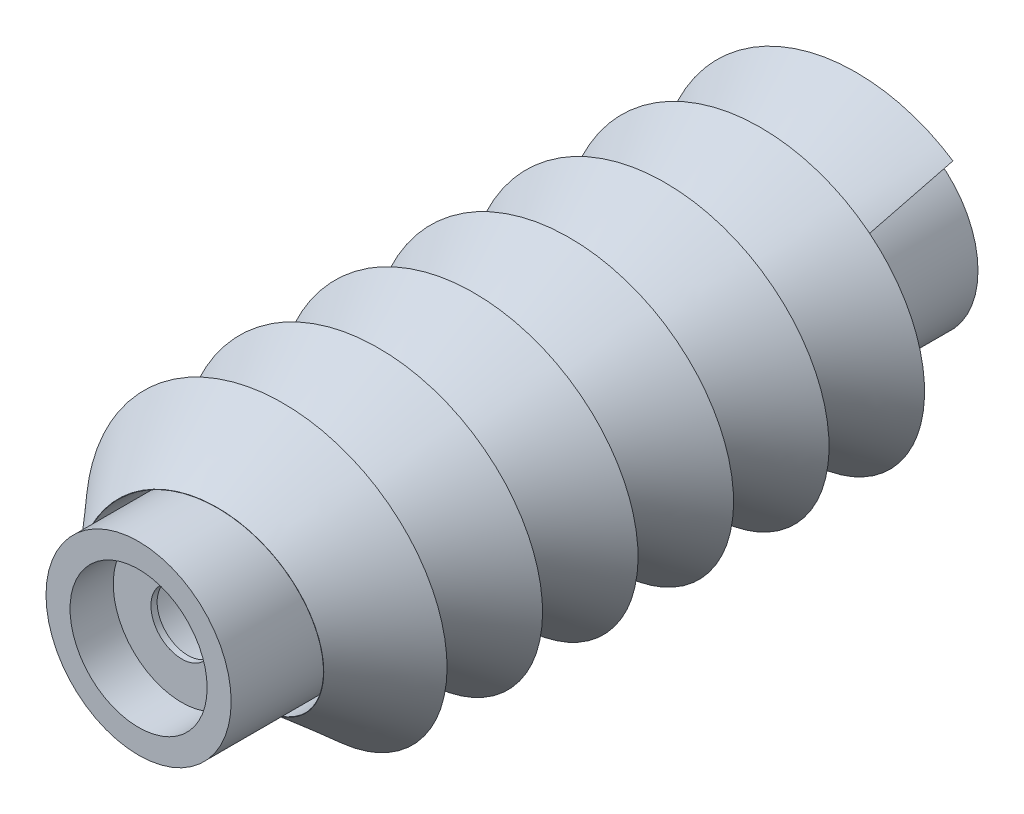
from build123d import *

# Parameters (mm, degrees)
SKETCH_1_R          = 15
SKETCH_1_R_2        = 11
EXTRUDE_1_DEPTH     = 63
SWEEP_1_PITCH       = 15.473846154
SKETCH_12_R         = 15
EXTRUDE_2_DEPTH     = 8
SKETCH_21_W         = 11.105
SKETCH_21_H         = 7
EXTRUDE_START       = 60
SKETCH_34_R         = 15
EXTRUDE_6_DEPTH     = 60
SKETCH_35_W         = 14
SKETCH_35_H         = 50
CUT_EXTRUDE_2_DEPTH = 20
MOVE_FACE_1_BY      = 10
SKETCH_44_W         = 5
SKETCH_44_H         = 20


with BuildPart() as part:
    # Эскиз1 → Бобышка-Вытянуть1 (new body)
    with BuildSketch(Plane.XY):
        Circle(SKETCH_1_R)
        Circle(SKETCH_1_R_2, mode=Mode.SUBTRACT)
    extrude(amount=EXTRUDE_1_DEPTH)

    # Эскиз12 → Бобышка-Вытянуть2 (add)
    with BuildSketch(Plane.XY.offset(63)):
        Circle(SKETCH_12_R)
    extrude(amount=EXTRUDE_2_DEPTH)

    # Эскиз21 → Отверстие1 (revolve, cut)
    with BuildSketch(Plane(origin=(0, 0, 71), x_dir=(0, -1, 0), z_dir=(1, 0, 0))):
        with Locations((5.5525, 3.5)):
            Rectangle(SKETCH_21_W, SKETCH_21_H)
    revolve(axis=Axis((0, 0, -39), (0, 0, 1)), mode=Mode.SUBTRACT)

    # Эскиз34 → Бобышка-Вытянуть6 (add)
    with BuildSketch(Plane(origin=(0, 0, 0), x_dir=(-1, 0, 0), z_dir=(0, 0, -1)).offset(EXTRUDE_START)):
        Circle(SKETCH_34_R)
    extrude(amount=-EXTRUDE_6_DEPTH)

    # Эскиз35 → Отверстие2 (revolve, cut)
    with BuildSketch(Plane(origin=(0, 0, -60), x_dir=(0, 1, 0), z_dir=(1, 0, 0))):
        with Locations((7, 25)):
            Rectangle(SKETCH_35_W, SKETCH_35_H)
    revolve(axis=Axis((0, 0, 50), (0, 0, -1)), mode=Mode.SUBTRACT)

    # Эскиз43 → Вырез-Вытянуть2 (cut)
    with BuildSketch(Plane(origin=(0, 0, -10), x_dir=(-1, 0, 0), z_dir=(0, 0, -1))):
        with BuildLine():
            Line((0.58, 2.173959521), (0.58, -2.173959521))
            ThreePointArc((0.58, -2.173959521), (-2.25, 0), (0.58, 2.173959521))
        make_face()
    extrude(amount=-CUT_EXTRUDE_2_DEPTH, mode=Mode.SUBTRACT)

    # Move Face 1: a face moved inward by 10.0
    extrude(part.faces().sort_by_distance((7.5, -12, -60))[0], amount=MOVE_FACE_1_BY, dir=(0, 0, 1), mode=Mode.SUBTRACT)

    # Эскиз44 → Отверстие3 (revolve, cut)
    with BuildSketch(Plane(origin=(0, 0, 64), x_dir=(0, -1, 0), z_dir=(1, 0, 0))):
        with Locations((2.5, 10)):
            Rectangle(SKETCH_44_W, SKETCH_44_H)
    revolve(axis=Axis((0, 0, -46), (0, 0, 1)), mode=Mode.SUBTRACT)


with BuildPart() as body_2:
    # По траектории1: the profile of Эскиз7 screwed along a right-hand helix of 6.5 turns, 18 arcs to a turn; built about Z, then put on its axis
    sweep_1_z = Axis((0, 0, 0), (0, 0, 1))
    sweep_1_corners = [(15, 0, 0), (15.738869287, -2.648152091, 16.129309555), (15.783333296, -2.648231163, 16.129791165), (25.270916097, -0.934380103, 5.691102854)]
    with BuildLine(mode=Mode.PRIVATE) as sweep_1_profile:
        Line(sweep_1_corners[0], sweep_1_corners[1])
        Line(sweep_1_corners[1], sweep_1_corners[2])
        Line(sweep_1_corners[2], sweep_1_corners[3])
        Line(sweep_1_corners[3], sweep_1_corners[0])
    sweep_1_cap = Face(sweep_1_profile.wire())
    sweep_1_turn_angles = [0, 10, 20, 30, 40, 50, 60, 70, 80, 90, 100, 110, 120, 130, 140, 150, 160, 170, 180, 190, 200, 210, 220, 230, 240, 250, 260, 270, 280, 290, 300, 310, 320, 330, 340, 350, 360]
    sweep_1_turn_weights = [1, 0.984807753012208, 1, 0.984807753012208, 1, 0.984807753012208, 1, 0.984807753012208, 1, 0.984807753012208, 1, 0.984807753012208, 1, 0.984807753012208, 1, 0.984807753012208, 1, 0.984807753012208, 1, 0.984807753012208, 1, 0.984807753012208, 1, 0.984807753012208, 1, 0.984807753012208, 1, 0.984807753012208, 1, 0.984807753012208, 1, 0.984807753012208, 1, 0.984807753012208, 1, 0.984807753012208, 1]
    sweep_1_turn_rails = [Edge.make_bspline([Vector(p[0], p[1], 0).rotate(sweep_1_z, sweep_1_turn_angles[k]) / sweep_1_turn_weights[k] + Vector(0, 0, p[2] + SWEEP_1_PITCH * sweep_1_turn_angles[k] / 360) for k in range(37)], [0, 0, 0, 1, 1, 2, 2, 3, 3, 4, 4, 5, 5, 6, 6, 7, 7, 8, 8, 9, 9, 10, 10, 11, 11, 12, 12, 13, 13, 14, 14, 15, 15, 16, 16, 17, 17, 18, 18, 18], 2, sweep_1_turn_weights) for p in sweep_1_corners]
    sweep_1_turn_sides = [Face.make_surface_from_curves(sweep_1_turn_rails[p[0]], sweep_1_turn_rails[p[1]]) for p in [(0, 1), (1, 2), (2, 3), (3, 0)]]
    sweep_1_last_angles = [2160, 2170, 2180, 2190, 2200, 2210, 2220, 2230, 2240, 2250, 2260, 2270, 2280, 2290, 2300, 2310, 2320, 2330, 2340]
    sweep_1_last_weights = [1, 0.984807753012208, 1, 0.984807753012208, 1, 0.984807753012208, 1, 0.984807753012208, 1, 0.984807753012208, 1, 0.984807753012208, 1, 0.984807753012208, 1, 0.984807753012208, 1, 0.984807753012208, 1]
    sweep_1_last_rails = [Edge.make_bspline([Vector(p[0], p[1], 0).rotate(sweep_1_z, sweep_1_last_angles[k]) / sweep_1_last_weights[k] + Vector(0, 0, p[2] + SWEEP_1_PITCH * sweep_1_last_angles[k] / 360) for k in range(19)], [0, 0, 0, 1, 1, 2, 2, 3, 3, 4, 4, 5, 5, 6, 6, 7, 7, 8, 8, 9, 9, 9], 2, sweep_1_last_weights) for p in sweep_1_corners]
    sweep_1_last_sides = [Face.make_surface_from_curves(sweep_1_last_rails[p[0]], sweep_1_last_rails[p[1]]) for p in [(0, 1), (1, 2), (2, 3), (3, 0)]]
    sweep_1 = Plane(origin=(0, 0, 0), x_dir=(0.6293203910498425, 0.7771459614569669, 0), z_dir=(0, 0, 1)) * Solid(Shell([*[p.moved(Location((0, 0, SWEEP_1_PITCH * i))) for i in range(6) for p in sweep_1_turn_sides], *sweep_1_last_sides, sweep_1_cap, sweep_1_cap.rotate(sweep_1_z, 2340).moved(Location((0, 0, SWEEP_1_PITCH * 2340 / 360)))]))
    add(sweep_1)


with BuildPart() as body_2_1:
    # Move Body 1: moved
    add(body_2.part.moved(Location((0, 0, -50))))


solid = Compound([part.part, body_2_1.part])
